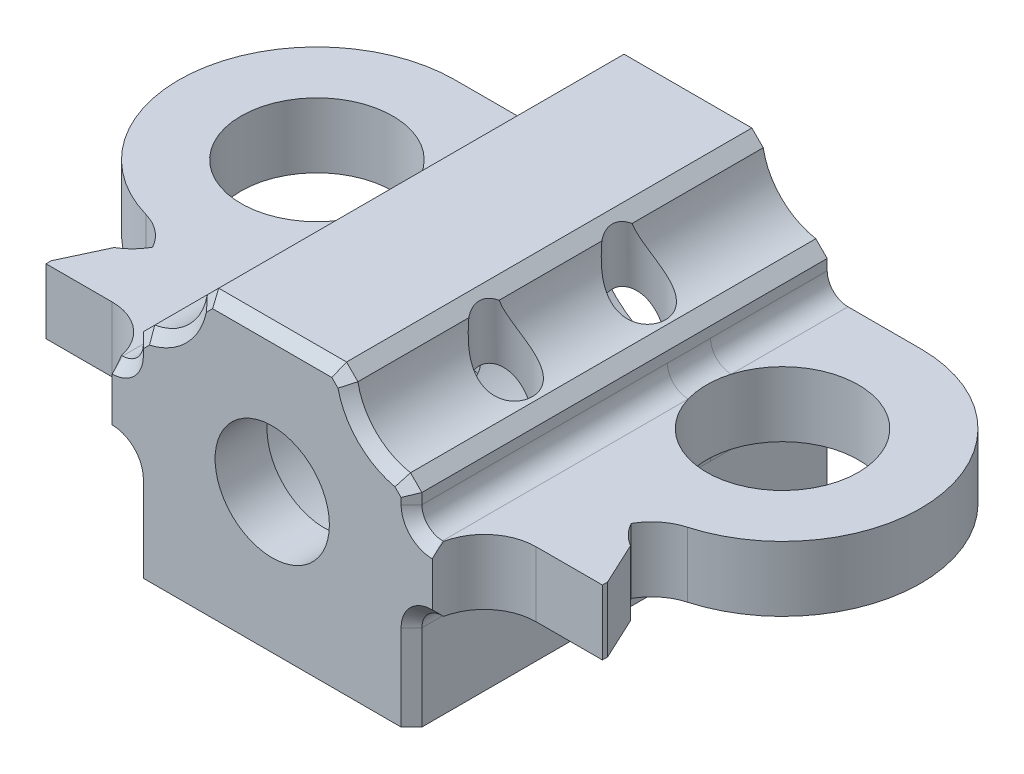
from build123d import *

# Parameters (mm, degrees)
SKETCH1_W           = 17.018
SKETCH1_H           = 17.018
BOSS_EXTRUDE1_DEPTH = 25.4
SKETCH4_R           = 1.016
CUT_EXTRUDE2_DEPTH  = 32.736026925
SKETCH5_R           = 4.6355
BOSS_EXTRUDE2_DEPTH = 1.984375
FILLET2_R           = 3.175
SKETCH7_R           = 3.96875
CUT_EXTRUDE3_DEPTH  = 39.061510253
FILLET3_R           = 1.27
CHAMFER1_SIZE       = 0.635
CHAMFER2_SIZE       = 0.635
CUT_EXTRUDE4_DEPTH  = 39.061510186
SKETCH9_R           = 1.3335
CUT_EXTRUDE5_DEPTH  = 3.81
SKETCH10_R          = 1.625
CUT_EXTRUDE6_DEPTH  = 13.97


with BuildPart() as part:
    # Sketch1 → Boss-Extrude1 (new body)
    with BuildSketch(Plane.XY):
        with Locations((0, 8.509)):
            Rectangle(SKETCH1_W, SKETCH1_H)
    extrude(amount=BOSS_EXTRUDE1_DEPTH)

    # Sketch2 → Cut-Revolve1 (revolve, cut)
    with BuildSketch(Plane(origin=(0, 0, 0), x_dir=(0, 0, -1), z_dir=(1, 0, 0)), mode=Mode.PRIVATE) as cut_revolve1_sk:
        Polygon((-22.225, 14.859), (-15.357768774, 14.859), (0, 14.859), (0, 8.509), (-12.182768774, 8.509), (-25.4, 8.509), (-25.4, 12.0015), (-22.225, 12.0015), align=None)
    revolve(cut_revolve1_sk.sketch.rotate(Axis((0, 8.509, 25.4), (0, 0, -1)), 90), axis=Axis((0, 8.509, 25.4), (0, 0, -1)), mode=Mode.SUBTRACT)

    # Sketch4 → Cut-Extrude2 (cut, through all)
    with BuildSketch(Plane.XZ):
        with Locations(Location((-5.999999938, 17.066338716, 0), (0, 0, 270))):
            Circle(SKETCH4_R)
        with Locations(Location((5.938000062, 17.066338716, 0), (0, 0, 270))):
            Circle(SKETCH4_R)
        with Locations(Location((5.938000062, 8.938338716, 0), (0, 0, 270))):
            Circle(SKETCH4_R)
        with Locations(Location((-5.999999938, 8.938338716, 0), (0, 0, 270))):
            Circle(SKETCH4_R)
    extrude(amount=-CUT_EXTRUDE2_DEPTH, mode=Mode.SUBTRACT)

    # Sketch5 → Boss-Extrude2 (add, symmetric)
    with BuildSketch(Plane(origin=(0, 8.509, 0), x_dir=(1, 0, 0), z_dir=(0, 1, 0))):
        with BuildLine():
            Line((8.509, 0), (14.224, 0))
            ThreePointArc((14.224, 0), (22.6695, -8.4455), (14.224, -16.891))
            Line((14.224, -16.891), (14.224, -19.286560272))
            Line((14.224, -19.286560272), (15.776044535, -19.286560272))
            Line((15.776044535, -19.286560272), (16.997431214, -21.905832458))
            Line((16.997431214, -21.905832458), (16.997431214, -25.4))
            Line((16.997431214, -25.4), (8.509, -25.4))
            Line((8.509, -25.4), (8.509, 0))
        make_face()
        with Locations(Location((14.224, -8.4455, 0), (0, 0, 270))):
            Circle(SKETCH5_R, mode=Mode.SUBTRACT)
    boss_extrude2 = extrude(amount=BOSS_EXTRUDE2_DEPTH, both=True)

    # Mirror1: Boss-Extrude2 across plane
    add(boss_extrude2.mirror(Plane(origin=(0, 0, 0), x_dir=(0, 0, 1), z_dir=(1, 0, 0))))

    # Fillet2
    # the kernel refuses this fillet: 3.175 mm, written as the material it adds along each edge
    with BuildSketch(Plane(origin=(14.224, 10.493375, 16.891), x_dir=(0.9904419281119169, 0, -0.13793037025234303), z_dir=(0, -1, 0))) as fillet2_piece_1:
        with BuildLine():
            CenterArc((2.767710809, 3.144653122), FILLET2_R, 187.928103341, 74.143793317)
            Line((-0.376942312, 2.706724196), (0, 0))
            ThreePointArc((0, 0), (1.164890942, 0.080722696), (2.329781884, 0))
        make_face()
    extrude(amount=3.96875)
    with BuildSketch(Plane(origin=(14.224, 10.493375, 19.286560272), x_dir=(0, 0, -1), z_dir=(0, -1, 0))) as fillet2_piece_2:
        with BuildLine():
            CenterArc((2.728853341, 3.175), FILLET2_R, 210.74159938, 59.25840062)
            Line((0, 1.552044535), (0, 0))
            Line((0, 0), (2.728853341, 0))
        make_face()
    extrude(amount=3.96875)
    with BuildSketch(Plane(origin=(-14.224, 10.493375, 19.286560272), x_dir=(0, 0, -1), z_dir=(0, -1, 0))) as fillet2_piece_3:
        with BuildLine():
            CenterArc((2.728853341, -3.175), FILLET2_R, 90, 59.25840062)
            Line((0, -1.552044535), (0, 0))
            Line((0, 0), (2.728853341, 0))
        make_face()
    extrude(amount=3.96875)
    with BuildSketch(Plane(origin=(-14.224, 10.493375, 16.891), x_dir=(-0.9904419281119169, 0, -0.13793037025234303), z_dir=(0, -1, 0))) as fillet2_piece_4:
        with BuildLine():
            CenterArc((2.767710809, -3.144653122), FILLET2_R, 97.928103341, 74.143793317)
            Line((-0.376942312, -2.706724196), (0, 0))
            ThreePointArc((0, 0), (1.164890942, -0.080722696), (2.329781884, 0))
        make_face()
    extrude(amount=3.96875)

    # Sketch7 → Cut-Extrude3 (cut, through all)
    with BuildSketch(Plane.XY.offset(25.4)):
        with Locations((8.509, 17.018)):
            Circle(SKETCH7_R)
        with Locations((-8.509, 17.018)):
            Circle(SKETCH7_R)
    extrude(amount=-CUT_EXTRUDE3_DEPTH, mode=Mode.SUBTRACT)

    # Fillet3
    fillet3_edges = [part.edges().sort_by_distance(p)[0] for p in [
        (-8.509, 6.524625, 12.7),
        (8.509, 6.524625, 12.7),
        (-8.509, 10.493375, 12.7),
        (8.509, 10.493375, 12.7),
    ]]
    fillet(fillet3_edges, radius=FILLET3_R)

    # Chamfer1
    # the kernel refuses this chamfer: 0.635 mm, written as the material it takes off along each edge
    with BuildSketch(Plane(origin=(8.509, 13.04925, -1.79748153), x_dir=(0, -1, 0), z_dir=(0, 0, 1))) as chamfer1_piece_1:
        with BuildLine():
            Line((CHAMFER1_SIZE, 0), (-0.061614969, -0.696614969))
            ThreePointArc((-0.061614969, -0.696614969), (-0.016308757, -0.359422847), (0, 0))
            Line((0, 0), (CHAMFER1_SIZE, 0))
        make_face()
    extrude(amount=28.994963061, mode=Mode.SUBTRACT)
    with BuildSketch(Plane(origin=(4.54025, 17.018, -1.79748153), x_dir=(0.08810514081728205, -0.9961111806227089, 0), z_dir=(0, 0, 1)), Plane(origin=(-8.509, 13.04925, -1.79748153), x_dir=(0.9961111806227088, 0.08810514081728424, 0), z_dir=(0, 0, 1))) as chamfer1_piece_2:
        with BuildLine():
            Line((0.699334555, 0), (-CHAMFER1_SIZE * 0.0881051408173, -CHAMFER1_SIZE * 0.996111180623))
            Line((-CHAMFER1_SIZE * 0.0881051408173, -CHAMFER1_SIZE * 0.996111180623), (0, 0))
            ThreePointArc((0, 0), (0.359462002, -0.015421665), (0.699334555, 0))
        make_face()
    extrude(amount=28.994963061, mode=Mode.SUBTRACT)
    with BuildSketch(Plane(origin=(-4.54025, 17.018, 27.19748153), x_dir=(1, 0, 0), z_dir=(0, 0, -1))) as chamfer1_piece_3:
        with BuildLine():
            Line((CHAMFER1_SIZE, 0), (-0.061614969, 0.696614969))
            ThreePointArc((-0.061614969, 0.696614969), (-0.016308757, 0.359422847), (0, 0))
            Line((0, 0), (CHAMFER1_SIZE, 0))
        make_face()
    extrude(amount=28.994963061, mode=Mode.SUBTRACT)

    # Chamfer2
    chamfer2_edges = [part.edges().sort_by_distance(p)[0] for p in [
        (8.509, 2.6273125, 25.4),
        (-13.388215607, 6.524625, 25.4),
        (-8.509, 2.6273125, 25.4),
        (13.388215607, 6.524625, 25.4),
        (-13.388215607, 10.493375, 25.4),
        (13.388215607, 10.493375, 25.4),
        (8.509, 12.0888125, 25.4),
        (-8.880974388, 6.152650612, 25.4),
        (8.880974388, 6.152650612, 25.4),
        (-8.880974388, 10.865349388, 25.4),
        (8.880974388, 10.865349388, 25.4),
        (-5.702669962, 14.211669962, 25.4),
        (-8.509, 12.0888125, 25.4),
        (5.702669962, 14.211669962, 25.4),
        (0, 17.018, 25.4),
        (-8.160692515, 12.762557485, 25.4),
        (-4.253557485, 16.669692515, 25.4),
        (4.253557485, 16.669692515, 25.4),
        (8.160692515, 12.762557485, 25.4),
        (16.997431214, 8.509, 25.4),
        (-16.997431214, 8.509, 25.4),
    ]]
    chamfer(chamfer2_edges, length=CHAMFER2_SIZE)

    # Sketch8 → Cut-Extrude4 (cut, through all)
    with BuildSketch(Plane(origin=(0, 17.018, 0), x_dir=(1, 0, 0), z_dir=(0, 1, 0))):
        with BuildLine():
            Line((-16.997431214, -22.225), (-12.954, -22.225))
            ThreePointArc((-12.954, -22.225), (-10.70893597, -23.15493597), (-9.779, -25.4))
            Line((-9.779, -25.4), (-16.997431214, -25.4))
            Line((-16.997431214, -25.4), (-16.997431214, -22.225))
        make_face()
        with BuildLine():
            Line((16.997431214, -25.4), (9.779, -25.4))
            ThreePointArc((9.779, -25.4), (10.70893597, -23.15493597), (12.954, -22.225))
            Line((12.954, -22.225), (16.997431214, -22.225))
            Line((16.997431214, -22.225), (16.997431214, -25.4))
        make_face()
    extrude(amount=-CUT_EXTRUDE4_DEPTH, mode=Mode.SUBTRACT)

    # Sketch9 → Cut-Extrude5 (cut)
    with BuildSketch(Plane(origin=(0, 0, 0), x_dir=(-1, 0, 0), z_dir=(0, 0, -1))):
        with Locations((8.382, 8.509)):
            Circle(SKETCH9_R)
        with Locations((-8.382, 8.509)):
            Circle(SKETCH9_R)
    extrude(amount=-CUT_EXTRUDE5_DEPTH, mode=Mode.SUBTRACT)

    # Sketch10 → Cut-Extrude6 (cut)
    with BuildSketch(Plane(origin=(0, 17.018, 0), x_dir=(1, 0, 0), z_dir=(0, 1, 0))):
        with Locations(Location((5.938000062, -8.938338716, 0), (0, 0, 270))):
            Circle(SKETCH10_R)
        with Locations(Location((-5.999999938, -8.938338716, 0), (0, 0, 329.36048461))):
            Circle(SKETCH10_R)
        with Locations(Location((5.938000062, -17.066338716, 0), (0, 0, 214.690678076))):
            Circle(SKETCH10_R)
        with Locations(Location((-5.999999938, -17.066338716, 0), (0, 0, 270))):
            Circle(SKETCH10_R)
    extrude(amount=-CUT_EXTRUDE6_DEPTH, mode=Mode.SUBTRACT)


solid = part.part
